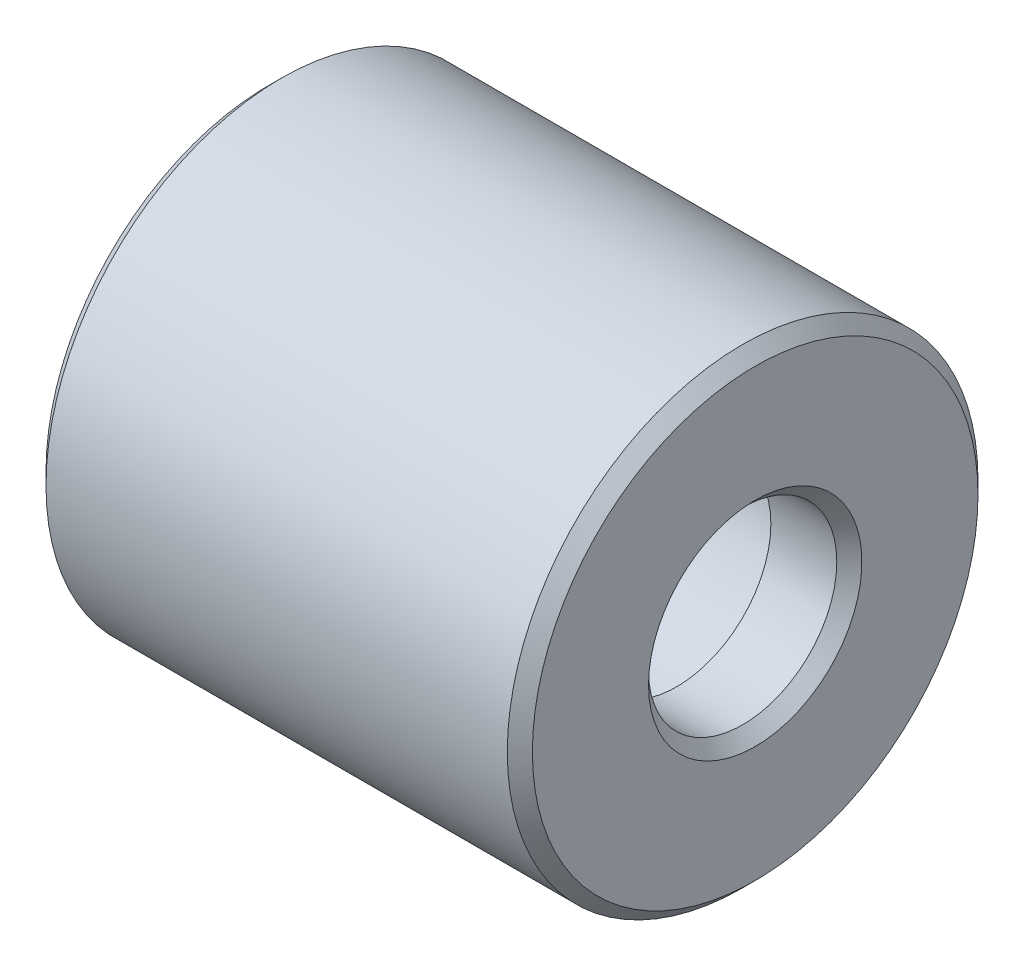
from build123d import *

# Parameters (mm, degrees)
CHAMFER1_SIZE = 0.508


with BuildPart() as part:
    # Sketch1 → Revolve1 (revolve)
    with BuildSketch(Plane.XY):
        Polygon((0, 5.55625), (16.51, 5.55625), (16.51, 3.81), (19.685, 3.81), (19.685, 9.525), (0, 9.525), align=None)
    revolve(axis=Axis((0, 0, 0), (1, 0, 0)))

    # Chamfer1
    chamfer1_edges = [part.edges().sort_by_distance(p)[0] for p in [
        (19.685, -3.81, 0),
        (0, -5.55625, 0),
        (19.685, -9.525, 0),
        (0, -9.525, 0),
    ]]
    chamfer(chamfer1_edges, length=CHAMFER1_SIZE)


solid = part.part
